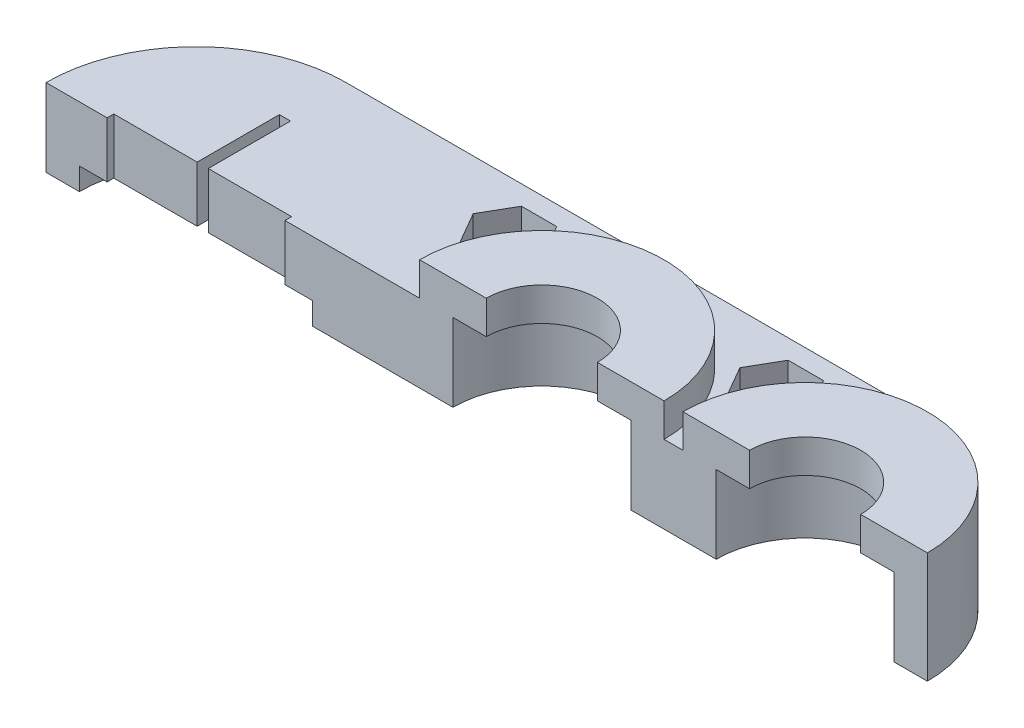
from build123d import *

# Parameters (mm, degrees)
SKETCH3_R               = 8
SKETCH3_W               = 54.803
SKETCH3_H               = 32
SKETCH3_R_2             = 5
BOSS_EXTRUDE1_DEPTH     = 7
CUT_EXTRUDE3_DEPTH      = 65.105926161
CUT_EXTRUDE3_DEPTH_BACK = 65.105926161
SKETCH4_R               = 1.75
CHAMFER1_SIZE           = 2.5
CUT_EXTRUDE5_DEPTH      = 65.105926161
CUT_EXTRUDE5_DEPTH_BACK = 65.105926161
SKETCH9_R               = 1.75
CUT_EXTRUDE6_START      = -2
SKETCH10_R              = 1.75
CUT_EXTRUDE6_DEPTH      = 2
CHAMFER3_SIZE2          = 22
CHAMFER3_SIZE           = 32
CHAMFER4_SIZE           = 16
FILLET1_DEPTH           = 7
BOSS_EXTRUDE6_START     = -5
SKETCH15_R              = 10.5
BOSS_EXTRUDE6_DEPTH     = 5
CUT_EXTRUDE7_DEPTH      = 65.105926161
CUT_EXTRUDE7_DEPTH_BACK = 65.105926161
SKETCH16_W              = 114.08603318
SKETCH16_H              = 61.147895568
BOSS_EXTRUDE7_DEPTH     = 3


with BuildPart() as part:
    # Sketch3 → Boss-Extrude1 (new body)
    # profile 1 of 10: a face of its own
    with BuildSketch(Plane(origin=(0, 0, 0), x_dir=(1, 0, 0), z_dir=(0, 1, 0))):
        with BuildLine():
            ThreePointArc((-17.613, 0), (-21.567058454, 9.545941546), (-31.113, 13.5))
            Line((-31.113, 13.5), (-31.113, 10.5))
            ThreePointArc((-31.113, 10.5), (-23.688378798, 7.424621202), (-20.613, 0))
            ThreePointArc((-20.613, 0), (-23.688378798, -7.424621202), (-31.113, -10.5))
            Line((-31.113, -10.5), (-31.113, -13.5))
            ThreePointArc((-31.113, -13.5), (-21.567058454, -9.545941546), (-17.613, 0))
        make_face()
    # profile 2 of 10: a face of its own
    with BuildSketch(Plane(origin=(0, 0, 0), x_dir=(1, 0, 0), z_dir=(0, 1, 0))):
        with BuildLine():
            Line((-31.113, 10.5), (-31.113, 13.5))
            ThreePointArc((-31.113, 13.5), (-44.613, 0), (-31.113, -13.5))
            Line((-31.113, -13.5), (-31.113, -10.5))
            ThreePointArc((-31.113, -10.5), (-41.613, 0), (-31.113, 10.5))
        make_face()
    # profile 3 of 10: a face of its own
    with BuildSketch(Plane(origin=(0, 0, 0), x_dir=(1, 0, 0), z_dir=(0, 1, 0))):
        with BuildLine():
            Line((23.69, 13.5), (-31.113, 13.5))
            ThreePointArc((-31.113, 13.5), (-21.567058454, 9.545941546), (-17.613, 0))
            ThreePointArc((-17.613, 0), (-21.567058454, -9.545941546), (-31.113, -13.5))
            Line((-31.113, -13.5), (23.69, -13.5))
            Line((23.69, -13.5), (23.69, -11))
            ThreePointArc((23.69, -11), (12.69, 0), (23.69, 11))
            Line((23.69, 11), (23.69, 13.5))
        make_face()
        with Locations(Location((0, 0, 0), (0, 0, 270))):
            Circle(SKETCH3_R, mode=Mode.SUBTRACT)
    # profile 4 of 10: a face of its own
    with BuildSketch(Plane(origin=(0, 0, 0), x_dir=(1, 0, 0), z_dir=(0, 1, 0))):
        with BuildLine():
            ThreePointArc((-17.613, 0), (-21.567058454, 9.545941546), (-31.113, 13.5))
            Line((-31.113, 13.5), (-31.113, 10.5))
            ThreePointArc((-31.113, 10.5), (-23.688378798, 7.424621202), (-20.613, 0))
            ThreePointArc((-20.613, 0), (-23.688378798, -7.424621202), (-31.113, -10.5))
            Line((-31.113, -10.5), (-31.113, -13.5))
            ThreePointArc((-31.113, -13.5), (-21.567058454, -9.545941546), (-17.613, 0))
        make_face()
    # profile 5 of 10: a face of its own
    with BuildSketch(Plane(origin=(0, 0, 0), x_dir=(1, 0, 0), z_dir=(0, 1, 0))):
        with BuildLine():
            Line((-31.113, 10.5), (-31.113, 13.5))
            ThreePointArc((-31.113, 13.5), (-44.613, 0), (-31.113, -13.5))
            Line((-31.113, -13.5), (-31.113, -10.5))
            ThreePointArc((-31.113, -10.5), (-41.613, 0), (-31.113, 10.5))
        make_face()
    # profile 6 of 10: a face of its own
    with BuildSketch(Plane(origin=(0, 0, 0), x_dir=(1, 0, 0), z_dir=(0, 1, 0))):
        with BuildLine():
            ThreePointArc((34.69, 0), (31.468174593, 7.778174593), (23.69, 11))
            Line((23.69, 11), (23.69, 8))
            ThreePointArc((23.69, 8), (29.346854249, 5.656854249), (31.69, 0))
            ThreePointArc((31.69, 0), (29.346854249, -5.656854249), (23.69, -8))
            Line((23.69, -8), (23.69, -11))
            ThreePointArc((23.69, -11), (31.468174593, -7.778174593), (34.69, 0))
        make_face()
    # profile 7 of 10: a face of its own
    with BuildSketch(Plane(origin=(0, 0, 0), x_dir=(1, 0, 0), z_dir=(0, 1, 0))):
        with BuildLine():
            Line((23.69, 8), (23.69, 11))
            ThreePointArc((23.69, 11), (12.69, 0), (23.69, -11))
            Line((23.69, -11), (23.69, -8))
            ThreePointArc((23.69, -8), (15.69, 0), (23.69, 8))
        make_face()
    # profile 8 of 10: a face of its own
    with BuildSketch(Plane(origin=(0, 0, 0), x_dir=(1, 0, 0), z_dir=(0, 1, 0))):
        with Locations((-3.7115, -29.5)):
            Rectangle(SKETCH3_W, SKETCH3_H)
        with Locations(Location((0, -32.707574931, 0), (0, 0, 270))):
            Circle(SKETCH3_R_2, mode=Mode.SUBTRACT)
    # profile 9 of 10: a face of its own
    with BuildSketch(Plane(origin=(0, 0, 0), x_dir=(1, 0, 0), z_dir=(0, 1, 0))):
        with BuildLine():
            ThreePointArc((34.69, 0), (31.468174593, 7.778174593), (23.69, 11))
            Line((23.69, 11), (23.69, 8))
            ThreePointArc((23.69, 8), (29.346854249, 5.656854249), (31.69, 0))
            ThreePointArc((31.69, 0), (29.346854249, -5.656854249), (23.69, -8))
            Line((23.69, -8), (23.69, -11))
            ThreePointArc((23.69, -11), (31.468174593, -7.778174593), (34.69, 0))
        make_face()
    # profile 10 of 10: a face of its own
    with BuildSketch(Plane(origin=(0, 0, 0), x_dir=(1, 0, 0), z_dir=(0, 1, 0))):
        with BuildLine():
            Line((23.69, 8), (23.69, 11))
            ThreePointArc((23.69, 11), (12.69, 0), (23.69, -11))
            Line((23.69, -11), (23.69, -8))
            ThreePointArc((23.69, -8), (15.69, 0), (23.69, 8))
        make_face()
    extrude(amount=BOSS_EXTRUDE1_DEPTH)

    # Sketch4 → Cut-Extrude3 (cut, two sides: drawn at the far end of the back side and taken through both)
    with BuildSketch(Plane(origin=(0, 0, 0), x_dir=(1, 0, 0), z_dir=(0, 1, 0)).offset(-CUT_EXTRUDE3_DEPTH_BACK)):
        with Locations(Location((5.5, -27.207574931, 0), (0, 0, 270))):
            Circle(SKETCH4_R)
        with Locations(Location((5.5, -38.207574931, 0), (0, 0, 270))):
            Circle(SKETCH4_R)
        with Locations(Location((-5.5, -38.207574931, 0), (0, 0, 270))):
            Circle(SKETCH4_R)
        with Locations(Location((-5.5, -27.207574931, 0), (0, 0, 270))):
            Circle(SKETCH4_R)
    extrude(amount=CUT_EXTRUDE3_DEPTH + CUT_EXTRUDE3_DEPTH_BACK, mode=Mode.SUBTRACT)

    # Chamfer1
    # the kernel refuses this chamfer: 2.5 mm, written as the material it adds along each edge
    with BuildSketch(Plane(origin=(23.69, 0, -11), x_dir=(0, 0, -1), z_dir=(0, 1, 0))) as chamfer1_piece_1_section:
        with BuildLine():
            Line((CHAMFER1_SIZE, 0), (-0.385093792, -2.885093792))
            ThreePointArc((-0.385093792, -2.885093792), (-0.102088007, -1.495163601), (0, 0))
            Line((0, 0), (CHAMFER1_SIZE, 0))
        make_face()
    chamfer1_piece_1 = extrude(amount=7, mode=Mode.PRIVATE)
    chamfer1_piece_1 = split(chamfer1_piece_1, bisect_by=Plane(origin=(23.69, 0, -13.5), z_dir=(0, 0, 1)), keep=Keep.TOP, mode=Mode.PRIVATE)
    add(chamfer1_piece_1)

    # Sketch9 → Cut-Extrude5 (cut, two sides: drawn at the far end of the back side and taken through both)
    with BuildSketch(Plane(origin=(0, 0, 0), x_dir=(1, 0, 0), z_dir=(0, 1, 0)).offset(-CUT_EXTRUDE5_DEPTH_BACK)):
        with Locations(Location((12, 9, 0), (0, 0, 270))):
            Circle(SKETCH9_R)
        with Locations(Location((12, -9, 0), (0, 0, 270))):
            Circle(SKETCH9_R)
        with Locations(Location((-12, -9, 0), (0, 0, 270))):
            Circle(SKETCH9_R)
        with Locations(Location((-12, 9, 0), (0, 0, 270))):
            Circle(SKETCH9_R)
    extrude(amount=CUT_EXTRUDE5_DEPTH + CUT_EXTRUDE5_DEPTH_BACK, mode=Mode.SUBTRACT)

    # Sketch10 → Cut-Extrude6 (cut)
    # profile 1 of 4: a face of its own
    with BuildSketch(Plane(origin=(0, 7, 0), x_dir=(1, 0, 0), z_dir=(0, 1, 0)).offset(CUT_EXTRUDE6_START)):
        Polygon((-15.175426481, -9), (-13.58771324, -11.75), (-10.41228676, -11.75), (-8.824573519, -9), (-10.41228676, -6.25), (-13.58771324, -6.25), align=None)
        with Locations(Location((-12, -9, 0), (0, 0, 270))):
            Circle(SKETCH10_R, mode=Mode.SUBTRACT)
    # profile 2 of 4: a face of its own
    with BuildSketch(Plane(origin=(0, 7, 0), x_dir=(1, 0, 0), z_dir=(0, 1, 0)).offset(CUT_EXTRUDE6_START)):
        Polygon((-15.175426481, 9), (-13.58771324, 6.25), (-10.41228676, 6.25), (-8.824573519, 9), (-10.41228676, 11.75), (-13.58771324, 11.75), align=None)
        with Locations(Location((-12, 9, 0), (0, 0, 270))):
            Circle(SKETCH10_R, mode=Mode.SUBTRACT)
    # profile 3 of 4: a face of its own
    with BuildSketch(Plane(origin=(0, 7, 0), x_dir=(1, 0, 0), z_dir=(0, 1, 0)).offset(CUT_EXTRUDE6_START)):
        Polygon((15.175426481, 9), (13.58771324, 11.75), (10.41228676, 11.75), (8.824573519, 9), (10.41228676, 6.25), (13.58771324, 6.25), align=None)
        with Locations(Location((12, 9, 0), (0, 0, 270))):
            Circle(SKETCH10_R, mode=Mode.SUBTRACT)
    # profile 4 of 4: a face of its own
    with BuildSketch(Plane(origin=(0, 7, 0), x_dir=(1, 0, 0), z_dir=(0, 1, 0)).offset(CUT_EXTRUDE6_START)):
        Polygon((15.175426481, -9), (13.58771324, -6.25), (10.41228676, -6.25), (8.824573519, -9), (10.41228676, -11.75), (13.58771324, -11.75), align=None)
        with Locations(Location((12, -9, 0), (0, 0, 270))):
            Circle(SKETCH10_R, mode=Mode.SUBTRACT)
    extrude(amount=CUT_EXTRUDE6_DEPTH, mode=Mode.SUBTRACT)

    # Chamfer2
    # the kernel refuses this chamfer: 5 mm, written as the material it adds along each edge
    with BuildSketch(Plane(origin=(23.69, 0, 11), x_dir=(0.9874000606639179, 0, -0.15824386307497393), z_dir=(0, 1, 0))) as chamfer2_piece_1:
        with BuildLine():
            Line((3.622786344, 0.141421356), (-0.805837357, -4.287202344))
            Line((-0.805837357, -4.287202344), (-0.904577363, -4.271377958))
            ThreePointArc((-0.904577363, -4.271377958), (-0.443767224, -2.137054655), (-0.098740006, 0.015824386))
            Line((-0.098740006, 0.015824386), (0.015824386, 0.098740006))
            ThreePointArc((0.015824386, 0.098740006), (1.81210794, -0.038365312), (3.606961958, 0.240161362))
            Line((3.606961958, 0.240161362), (3.622786344, 0.141421356))
        make_face()
    extrude(amount=7)

    # Chamfer3
    chamfer3_edges = [part.edges().sort_by_distance(p)[0] for p in [
        (-31.113, 3.5, 45.5),
    ]]
    chamfer3_side = [part.faces().sort_by_distance(p)[0] for p in [
        (-31.113, 3.5, 45.06),
    ]]
    chamfer(chamfer3_edges, length=CHAMFER3_SIZE - 0.0001, length2=CHAMFER3_SIZE2 - 0.0001, reference=chamfer3_side[0])  # a hair under: the kernel refuses the full size

    # Chamfer4
    chamfer4_edges = [part.edges().sort_by_distance(p)[0] for p in [
        (23.69, 3.5, 45.5),
    ]]
    chamfer(chamfer4_edges, length=CHAMFER4_SIZE)

    # Fillet1: read off the stored shape, not the designer's step
    # Fillet1 outline → Fillet1 (add)
    with BuildSketch(Plane(origin=(0, 0, 0), x_dir=(1, 0, 0), z_dir=(0, 1, 0))):
        with BuildLine():
            ThreePointArc((-31.113, -13.5), (-32.547033058, -13.423619079), (-33.96483904, -13.19534062))
            ThreePointArc((-33.96483904, -13.19534062), (-31.199410591, -14.370304214), (-29.062482337, -16.482571146))
            Line((-29.062482337, -16.482571146), (-31.113, -13.5))
        make_face()
    extrude(amount=FILLET1_DEPTH)

    # Sketch15 → Boss-Extrude6 (add)
    with BuildSketch(Plane(origin=(0, 7, 0), x_dir=(1, 0, 0), z_dir=(0, 1, 0)).offset(BOSS_EXTRUDE6_START)):
        with Locations(Location((-31.113, 0, 0), (0, 0, 270))):
            Circle(SKETCH15_R)
        Polygon((-31.613, 0.6), (-31.613, 8), (-30.613, 8), (-30.613, 0.6), (-23.113, 0.6), (-23.113, -0.6), (-30.613, -0.6), (-30.613, -8), (-31.613, -8), (-31.613, -0.6), (-39.113, -0.6), (-39.113, 0.6), align=None, mode=Mode.SUBTRACT)
    extrude(amount=BOSS_EXTRUDE6_DEPTH)

    # Sketch16 → Cut-Extrude7 (cut, two sides: drawn at the far end of the back side and taken through both)
    with BuildSketch(Plane(origin=(0, 0, 0), x_dir=(1, 0, 0), z_dir=(0, 1, 0)).offset(-CUT_EXTRUDE7_DEPTH_BACK)):
        with Locations((4.584286452, -30.573947784)):
            Rectangle(SKETCH16_W, SKETCH16_H)
    extrude(amount=CUT_EXTRUDE7_DEPTH + CUT_EXTRUDE7_DEPTH_BACK, mode=Mode.SUBTRACT)

    # Sketch17 → Boss-Extrude7 (add)
    with BuildSketch(Plane(origin=(0, 7, 0), x_dir=(1, 0, 0), z_dir=(0, 1, 0))):
        with BuildLine():
            ThreePointArc((-5, 0), (0, 5), (5, 0))
            Line((5, 0), (8, 0))
            ThreePointArc((8, 0), (0, 8), (-8, 0))
            Line((-8, 0), (-5, 0))
        make_face()
        with BuildLine():
            ThreePointArc((-8, 0), (0, 8), (8, 0))
            Line((8, 0), (11, 0))
            ThreePointArc((11, 0), (0, 11), (-11, 0))
            Line((-11, 0), (-8, 0))
        make_face()
        with BuildLine():
            ThreePointArc((31.69, 0), (23.69, 8), (15.69, 0))
            Line((15.69, 0), (18.69, 0))
            ThreePointArc((18.69, 0), (23.69, 5), (28.69, 0))
            Line((28.69, 0), (31.69, 0))
        make_face()
        with BuildLine():
            ThreePointArc((26.575093792, 10.614906208), (17.009282662, 8.738879554), (12.69, 0))
            Line((12.69, 0), (15.69, 0))
            ThreePointArc((15.69, 0), (23.69, 8), (31.69, 0))
            Line((31.69, 0), (34.69, 0))
            ThreePointArc((34.69, 0), (32.428879554, 6.680717338), (26.575093792, 10.614906208))
        make_face()
    extrude(amount=BOSS_EXTRUDE7_DEPTH)


solid = part.part
